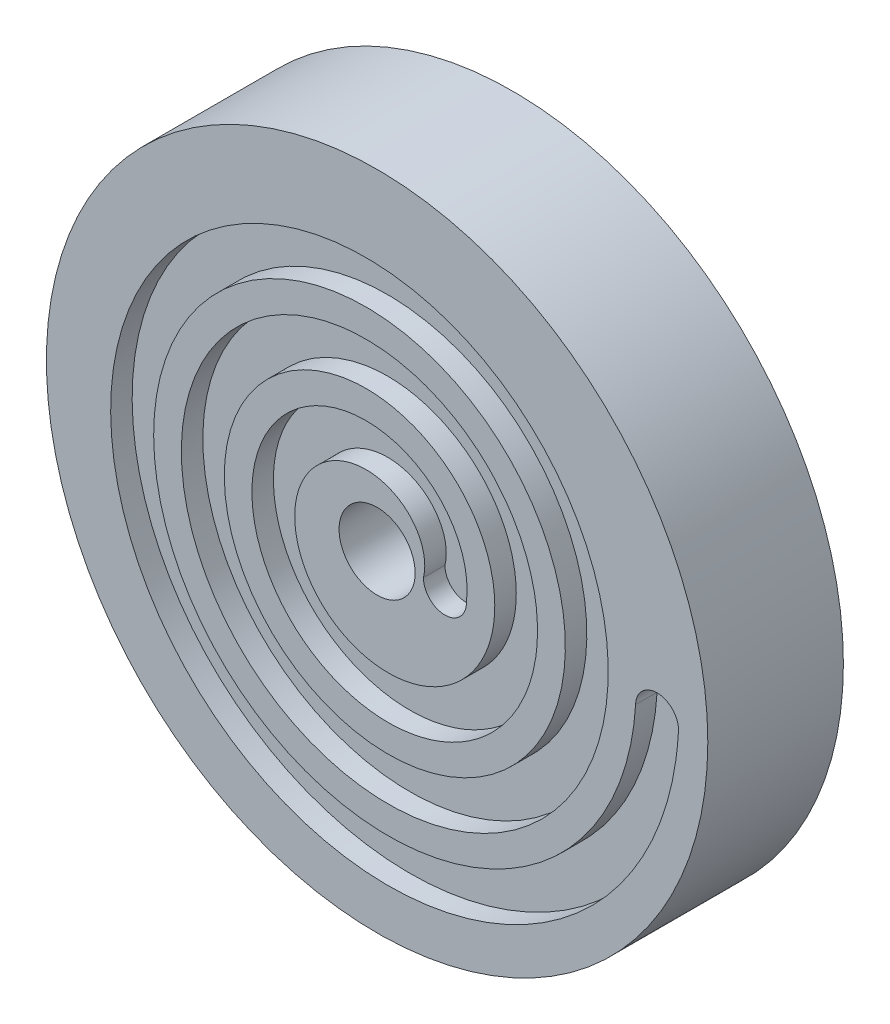
from build123d import *

# Parameters (mm, degrees)
SKETCH4_R           = 100
SKETCH4_R_2         = 5.5
SKETCH4_R_3         = 1.5
BOSS_EXTRUDE1_DEPTH = 41
SKETCH3_R           = 8.249941975
SKETCH3_R_2         = 8.2
SKETCH3_R_3         = 8.4
CUT_EXTRUDE1_DEPTH  = 15.6
SKETCH15_R          = 8.2
SKETCH15_R_2        = 8.249941975
SKETCH15_R_3        = 8.4
CUT_EXTRUDE12_DEPTH = 16.4
CUT_EXTRUDE12_TAPER = 20
SKETCH6_R           = 11.5
CUT_EXTRUDE3_DEPTH  = 38.6
CUT_EXTRUDE13_DEPTH = 6.5


with BuildPart() as part:
    # Sketch4 → Boss-Extrude1 (new body)
    with BuildSketch(Plane.XY):
        Circle(SKETCH4_R)
        Circle(SKETCH4_R_2, mode=Mode.SUBTRACT)
        with Locations((-8, 0)):
            Circle(SKETCH4_R_3, mode=Mode.SUBTRACT)
        with Locations((8, 0)):
            Circle(SKETCH4_R_3, mode=Mode.SUBTRACT)
        with Locations((0, 8)):
            Circle(SKETCH4_R_3, mode=Mode.SUBTRACT)
        with Locations((0, -8)):
            Circle(SKETCH4_R_3, mode=Mode.SUBTRACT)
    extrude(amount=BOSS_EXTRUDE1_DEPTH)

    # Sketch3 → Cut-Extrude1 (cut)
    with BuildSketch(Plane.XY):
        with Locations((21.4, 0)):
            Circle(SKETCH3_R)
        with Locations((16.087685707, 18.190157142)):
            Circle(SKETCH3_R_2)
        with Locations((-0.774491715, 26.837091431)):
            Circle(SKETCH3_R_2)
        with Locations((-19.110818022, 22.053615962)):
            Circle(SKETCH3_R_2)
        with Locations((-30.557474359, 6.951412193)):
            Circle(SKETCH3_R_2)
        with Locations((-31.122710428, -11.990156068)):
            Circle(SKETCH3_R_2)
        with Locations((-21.220186354, -28.146966302)):
            Circle(SKETCH3_R_2)
        with Locations((-4.356772791, -36.791489598)):
            Circle(SKETCH3_R_2)
        with Locations((14.573130819, -35.918993574)):
            Circle(SKETCH3_R_2)
        with Locations((30.806228108, -26.142028174)):
            Circle(SKETCH3_R_2)
        with Locations((40.765665437, -10.020238321)):
            Circle(SKETCH3_R_2)
        with Locations((42.589055998, 8.841833327)):
            Circle(SKETCH3_R_2)
        with Locations((36.192728346, 26.679700144)):
            Circle(SKETCH3_R_2)
        with Locations((22.997258321, 40.280511548)):
            Circle(SKETCH3_R_2)
        with Locations((5.454874382, 47.447607593)):
            Circle(SKETCH3_R_2)
        with Locations((-13.495125618, 47.207297832)):
            Circle(SKETCH3_R_2)
        with Locations((-30.933667375, 39.791115431)):
            Circle(SKETCH3_R_2)
        with Locations((-44.388521746, 26.446850976)):
            Circle(SKETCH3_R_2)
        with Locations((-52.112569576, 9.142470458)):
            Circle(SKETCH3_R_2)
        with Locations((-53.228480323, -9.774644629)):
            Circle(SKETCH3_R_2)
        with Locations((-47.740836122, -27.912678181)):
            Circle(SKETCH3_R_2)
        with Locations((-36.441454543, -43.125385892)):
            Circle(SKETCH3_R_2)
        with Locations((-20.738121403, -53.732356633)):
            Circle(SKETCH3_R_2)
        with Locations((-2.439397282, -58.657719113)):
            Circle(SKETCH3_R_2)
        with Locations((16.474376824, -57.486544888)):
            Circle(SKETCH3_R_2)
        with Locations((34.068250676, -50.446793268)):
            Circle(SKETCH3_R_2)
        with Locations((48.6385902, -38.330370275)):
            Circle(SKETCH3_R_2)
        with Locations((58.854915628, -22.370132346)):
            Circle(SKETCH3_R_2)
        with Locations((63.851191035, -4.090642964)):
            Circle(SKETCH3_R_2)
        with Locations((63.265715225, 14.850310498)):
            Circle(SKETCH3_R_2)
        with Locations((57.233338919, 32.814523148)):
            Circle(SKETCH3_R_2)
        with Locations((46.337082588, 48.318525791)):
            Circle(SKETCH3_R_2)
        with Locations((31.528394784, 60.14245346)):
            Circle(SKETCH3_R_2)
        with Locations((14.02631126, 67.40740854)):
            Circle(SKETCH3_R_2)
        with Locations((-4.794157343, 69.619299485)):
            Circle(SKETCH3_R_2)
        with Locations((-23.51480359, 66.679928104)):
            Circle(SKETCH3_R_2)
        with Locations((-40.779852981, 58.868361711)):
            Circle(SKETCH3_R_2)
        with Locations((-55.387799155, 46.797305064)):
            Circle(SKETCH3_R_2)
        with Locations((-66.364652435, 31.350260296)):
            Circle(SKETCH3_R_2)
        with Locations((-73.015701888, 13.60579521)):
            Circle(SKETCH3_R_2)
        with Locations((-74.954667493, -5.244746225)):
            Circle(SKETCH3_R_2)
        with Locations((-72.110731724, -23.980127975)):
            Circle(SKETCH3_R_2)
        with Locations((-64.715218858, -41.427445518)):
            Circle(SKETCH3_R_2)
        with Locations((-53.27083426, -56.531370875)):
            Circle(SKETCH3_R_2)
        with Locations((-21.324502844, -76.402883691)):
            Circle(SKETCH3_R_2)
        with Locations((-2.736063948, -80.086962869)):
            Circle(SKETCH3_R_2)
        with Locations((16.197542751, -79.298903632)):
            Circle(SKETCH3_R_2)
        with Locations((-38.506875647, -68.411102609)):
            Circle(SKETCH3_R_2)
        with Locations((34.427838761, -74.126012041)):
            Circle(SKETCH3_R_2)
        with Locations((50.974911884, -64.890381524)):
            Circle(SKETCH3_R_2)
        with Locations((64.976177653, -52.120610309)):
            Circle(SKETCH3_R_3)
    extrude(amount=CUT_EXTRUDE1_DEPTH, mode=Mode.SUBTRACT)

    # Sketch15 → Cut-Extrude12 (cut)
    with BuildSketch(Plane.XY.offset(15.6)):
        with Locations((16.087685707, 18.190157143)):
            Circle(SKETCH15_R)
        with Locations((-0.774491715, 26.837091431)):
            Circle(SKETCH15_R)
        with Locations((-19.110818022, 22.053615962)):
            Circle(SKETCH15_R)
        with Locations((-30.557474359, 6.951412193)):
            Circle(SKETCH15_R)
        with Locations((-31.122710428, -11.990156068)):
            Circle(SKETCH15_R)
        with Locations((-21.220186354, -28.146966302)):
            Circle(SKETCH15_R)
        with Locations((-4.356772791, -36.791489598)):
            Circle(SKETCH15_R)
        with Locations((14.573130819, -35.918993574)):
            Circle(SKETCH15_R)
        with Locations((30.806228108, -26.142028174)):
            Circle(SKETCH15_R)
        with Locations((40.765665437, -10.020238321)):
            Circle(SKETCH15_R)
        with Locations((42.589055998, 8.841833327)):
            Circle(SKETCH15_R)
        with Locations((36.192728346, 26.679700144)):
            Circle(SKETCH15_R)
        with Locations((22.997258321, 40.280511548)):
            Circle(SKETCH15_R)
        with Locations((5.454874382, 47.447607593)):
            Circle(SKETCH15_R)
        with Locations((-13.495125618, 47.207297832)):
            Circle(SKETCH15_R)
        with Locations((-30.933667375, 39.791115431)):
            Circle(SKETCH15_R)
        with Locations((-44.388521746, 26.446850976)):
            Circle(SKETCH15_R)
        with Locations((-52.112569576, 9.142470458)):
            Circle(SKETCH15_R)
        with Locations((-53.228480323, -9.774644629)):
            Circle(SKETCH15_R)
        with Locations((-47.740836122, -27.912678181)):
            Circle(SKETCH15_R)
        with Locations((-36.441454543, -43.125385892)):
            Circle(SKETCH15_R)
        with Locations((-20.738121403, -53.732356633)):
            Circle(SKETCH15_R)
        with Locations((-2.439397282, -58.657719113)):
            Circle(SKETCH15_R)
        with Locations((16.474376824, -57.486544888)):
            Circle(SKETCH15_R)
        with Locations((34.068250676, -50.446793268)):
            Circle(SKETCH15_R)
        with Locations((48.6385902, -38.330370275)):
            Circle(SKETCH15_R)
        with Locations((58.854915628, -22.370132346)):
            Circle(SKETCH15_R)
        with Locations((63.851191035, -4.090642964)):
            Circle(SKETCH15_R)
        with Locations((63.265715225, 14.850310498)):
            Circle(SKETCH15_R)
        with Locations((57.233338919, 32.814523148)):
            Circle(SKETCH15_R)
        with Locations((46.337082588, 48.318525791)):
            Circle(SKETCH15_R)
        with Locations((31.528394784, 60.14245346)):
            Circle(SKETCH15_R)
        with Locations((14.02631126, 67.40740854)):
            Circle(SKETCH15_R)
        with Locations((-4.794157343, 69.619299485)):
            Circle(SKETCH15_R)
        with Locations((-23.51480359, 66.679928104)):
            Circle(SKETCH15_R)
        with Locations((-40.779852981, 58.868361711)):
            Circle(SKETCH15_R)
        with Locations((-55.387799155, 46.797305064)):
            Circle(SKETCH15_R)
        with Locations((-66.364652435, 31.350260296)):
            Circle(SKETCH15_R)
        with Locations((-73.015701888, 13.60579521)):
            Circle(SKETCH15_R)
        with Locations((-74.954667493, -5.244746225)):
            Circle(SKETCH15_R)
        with Locations((-72.110731724, -23.980127975)):
            Circle(SKETCH15_R)
        with Locations((-64.715218858, -41.427445518)):
            Circle(SKETCH15_R)
        with Locations((-53.27083426, -56.531370875)):
            Circle(SKETCH15_R)
        with Locations((-21.324502844, -76.402883691)):
            Circle(SKETCH15_R)
        with Locations((-2.736063948, -80.086962869)):
            Circle(SKETCH15_R)
        with Locations((16.197542751, -79.298903632)):
            Circle(SKETCH15_R)
        with Locations((-38.506875647, -68.411102609)):
            Circle(SKETCH15_R)
        with Locations((34.427838761, -74.126012041)):
            Circle(SKETCH15_R)
        with Locations((50.974911884, -64.890381524)):
            Circle(SKETCH15_R)
        with Locations((21.4, 0)):
            Circle(SKETCH15_R_2)
        with Locations((64.976177653, -52.120610309)):
            Circle(SKETCH15_R_3)
    extrude(amount=CUT_EXTRUDE12_DEPTH, taper=CUT_EXTRUDE12_TAPER, mode=Mode.SUBTRACT)

    # Sketch6 → Cut-Extrude3 (cut)
    with BuildSketch(Plane.XY.offset(41)):
        Circle(SKETCH6_R)
    extrude(amount=-CUT_EXTRUDE3_DEPTH, mode=Mode.SUBTRACT)

    # Sketch16 → Cut-Extrude13 (cut)
    with BuildSketch(Plane.XY.offset(41)):
        with BuildLine():
            add(Edge.make_bspline(
                [(14.016506821, 0.058890958), (14.030574535, 0.116716229), (14.057928972, 0.232859004), (14.104443607, 0.440692181), (14.16063629, 0.715902607), (14.220020621, 1.042704993), (14.281273921, 1.437343973), (14.339018355, 1.904396529), (14.383943259, 2.436853645), (14.409163219, 2.972356735), (14.414178912, 3.507524072), (14.400801014, 3.995209172), (14.374468574, 4.434233739), (14.33262169, 4.910561619), (14.271432193, 5.423399716), (14.123061594, 6.358742999), (13.843675569, 7.532641897), (13.400923875, 8.853033449), (12.748018385, 10.28821652), (12.049784249, 11.521411814), (11.239008296, 12.699181377), (10.102628408, 14.078658887), (8.558785803, 15.572180082), (6.531913632, 17.053121526), (3.975685711, 18.353947247), (1.249227269, 19.242541549), (-1.579574136, 19.709530886), (-4.445829595, 19.755622123), (-7.288637583, 19.390176133), (-10.051801675, 18.63028947), (-12.684444392, 17.499185446), (-15.392709382, 15.875078562), (-18.057901444, 13.676220687), (-21.275934542, 9.987915161), (-24.195506858, 4.315677697), (-25.535539666, -3.153146414), (-24.092076196, -11.764773521), (-19.952360348, -19.437726336), (-13.644024825, -25.439231987), (-5.8377308, -29.274029228), (2.735606339, -30.68616375), (11.353928774, -29.641306539), (19.357711549, -26.295728306), (26.188520056, -20.957885021), (31.413305575, -14.046800183), (34.736362346, -6.050750873), (36.000713563, 2.511223909), (35.181153937, 11.123250755), (32.370965466, 19.301292866), (27.764286374, 26.615640725), (21.635814835, 32.707546426), (14.319295246, 37.2999838), (6.186055674, 40.20306017), (-2.375486418, 41.314818693), (-10.978574543, 40.61805958), (-19.254287918, 38.173764196), (-26.865733738, 34.112304836), (-34.399674023, 27.895198951), (-41.641770411, 18.365513654), (-46.646531233, 5.014292638), (-46.83439662, -11.490474185), (-40.751998747, -27.915741612), (-29.329328027, -41.169358956), (-14.086268223, -49.724401059), (3.121864615, -52.704434499), (20.346471287, -49.907809195), (35.76184155, -41.757844852), (47.83830905, -29.196035285), (55.462713309, -13.539541851), (58.003920293, 3.678009305), (55.326397306, 20.865316223), (47.758668261, 36.517691793), (36.026348394, 49.33694563), (21.16024185, 58.32093463), (4.390465358, 62.819465545), (-12.963412332, 62.557299127), (-29.597563451, 57.626701234), (-44.317018546, 48.454228793), (-56.112342987, 35.747175454), (-64.216079082, 20.425898), (-68.137801395, 3.548245412), (-67.678038673, -13.768124536), (-62.922479609, -30.420247316), (-54.219185031, -45.38720808), (-43.651361889, -56.236760006), (-32.954454266, -63.494325094), (-23.221801799, -68.02856966), (-15.058604975, -70.70103381), (-6.636311382, -72.386063039), (1.925790494, -73.065612602), (10.508228023, -72.735811745), (18.993339126, -71.406716641), (27.266597386, -69.101746745), (35.218206373, -65.857047567), (42.744362943, -61.720640911), (49.748476928, -56.751515747), (56.142212764, -51.018573978), (61.84646485, -44.599480968), (66.483003279, -38.018212975), (69.630451094, -32.402983303), (71.669044582, -28.032192447), (72.890905092, -25.059669464), (73.650031993, -23.056101044), (74.3531948, -21.032200415), (74.999918121, -18.989587808), (75.58977707, -16.9297969), (76.122382679, -14.854527811), (76.597406628, -12.765221981), (77.014539663, -10.663772319), (77.32868567, -8.815349339), (77.561470199, -7.225764804), (77.731145655, -5.897109574), (77.852187948, -4.833599155), (77.958682677, -3.766886567), (78.039130941, -2.830812788), (78.097695572, -2.048738747), (78.136069915, -1.454765093), (78.15064743, -1.215692758), (78.157590282, -1.096828249)],
                knots=[0.021797208, 0.021797208, 0.021797208, 0.021797208, 0.021797208, 0.022070601, 0.022343994, 0.022617387, 0.02289078, 0.023437566, 0.023984352, 0.024531138, 0.025077924, 0.02562471, 0.026171496, 0.026523079, 0.026874662, 0.027577829, 0.028280995, 0.030390495, 0.031796828, 0.033255306, 0.034713783, 0.036172261, 0.037630738, 0.040547765, 0.043464792, 0.046382033, 0.049299273, 0.052216621, 0.055133969, 0.058051462, 0.060968955, 0.063886241, 0.066803528, 0.070914401, 0.075025275, 0.083776953, 0.092528419, 0.101280003, 0.110031978, 0.118783654, 0.127535121, 0.136286831, 0.145038746, 0.153790412, 0.16254192, 0.171293761, 0.18004559, 0.188797183, 0.197548795, 0.206300627, 0.215052496, 0.223804074, 0.232555695, 0.241307631, 0.250059377, 0.258810962, 0.267562665, 0.276314579, 0.285066304, 0.298455126, 0.315958252, 0.333461537, 0.350964737, 0.36846801, 0.385971403, 0.403474742, 0.420977928, 0.438481325, 0.455984635, 0.473487957, 0.490991256, 0.50849458, 0.525997955, 0.543501446, 0.561004684, 0.578508057, 0.59601144, 0.613514849, 0.6310183, 0.648521662, 0.666025025, 0.683528428, 0.701031873, 0.718535323, 0.736038666, 0.753542142, 0.762293873, 0.771045605, 0.779797319, 0.788549034, 0.797300747, 0.806052461, 0.814804161, 0.82355586, 0.832307543, 0.841059225, 0.849810982, 0.858562738, 0.867314419, 0.8760661, 0.882629917, 0.884817856, 0.887005794, 0.889193733, 0.891381672, 0.893569611, 0.895757552, 0.897945493, 0.900133434, 0.902321374, 0.904509315, 0.905603285, 0.906697256, 0.907791226, 0.908885196, 0.909979167, 0.910526152, 0.911073137, 0.911073137, 0.911073137, 0.911073137, 0.911073137], degree=4))
            ThreePointArc((14.016506821, 0.058890958), (20.478807931, -6.462301111), (27, 0))
            add(Edge.make_bspline(
                [(27, 0), (27.012739488, 0.100990806), (27.036662544, 0.301357926), (27.08007804, 0.693733517), (27.122697184, 1.159954432), (27.151882127, 1.559556129), (27.172474927, 1.906834305), (27.189208246, 2.255296673), (27.201944335, 2.603796035), (27.210920791, 3.009886722), (27.213266128, 3.474287749), (27.207699312, 3.938733208), (27.163906616, 5.447543308), (26.983883763, 7.299839782), (26.585879779, 9.475040065), (25.878898367, 11.931545894), (25.187746783, 13.849179676), (24.28422983, 15.875178652), (23.13283807, 17.979244172), (21.700129204, 20.122283143), (20.052019791, 22.172952205), (18.190820043, 24.10706676), (16.121864453, 25.899645529), (13.853790414, 27.52533588), (11.447221202, 28.937881804), (8.923198601, 30.127846853), (6.303093091, 31.087857374), (3.608419345, 31.812552164), (0.860708309, 32.298543174), (-1.918743906, 32.5443425), (-4.708978431, 32.550313014), (-7.489523033, 32.318520967), (-10.928137463, 31.736319164), (-14.956977718, 30.580266173), (-19.434944922, 28.594213656), (-24.116201975, 25.525140807), (-28.247160837, 21.74883894), (-31.732756976, 17.370496363), (-35.189260731, 11.289708766), (-37.786229321, 3.26311959), (-38.40323412, -6.614775737), (-35.828505022, -17.62022044), (-30.268166493, -27.451854964), (-22.227155159, -35.37436817), (-12.359923315, -40.844401386), (-1.407702232, -43.528219226), (9.861036151, -43.302612171), (20.703438331, -40.241801157), (30.446441071, -34.59388519), (38.521090271, -26.749704853), (44.486412297, -17.207228633), (48.043193614, -6.53427377), (49.038504965, 4.668252409), (47.46195427, 15.800656351), (43.435056274, 26.29508879), (37.195172281, 35.641238539), (29.07565872, 43.406606686), (19.483333963, 49.251203762), (8.874974771, 52.936547392), (-2.266370549, 54.329262909), (-13.45377851, 53.400118987), (-24.217303988, 50.218207634), (-34.121827115, 44.942532549), (-42.782826393, 37.80919418), (-51.19505312, 27.50543576), (-58.125446718, 12.864594868), (-60.776618592, -6.143787337), (-55.926184539, -27.685242585), (-43.255931225, -46.631660559), (-24.731552991, -59.877752243), (-2.783641133, -65.883807353), (19.881754851, -64.067123739), (40.621302412, -54.783800233), (57.145304349, -39.207977312), (67.735958985, -19.136422569), (71.381558574, 3.250194948), (67.823910288, 25.638844955), (57.52670101, 45.822154372), (41.577932435, 61.901822033), (21.544207816, 72.442996411), (-0.70420917, 76.571772757), (-23.178444361, 74.014145882), (-43.9493714, 65.07994323), (-61.304597959, 50.599521164), (-73.874594393, 31.823569111), (-79.864659761, 12.988722809), (-81.133179848, -3.809003087), (-79.317927652, -20.483437692), (-74.481864819, -36.617305957), (-66.094423653, -51.319040702), (-54.702507123, -63.717337263), (-41.352009346, -73.865323636), (-28.863979091, -80.258288669), (-16.79204499, -83.951913485), (-5.743537725, -85.56160931), (1.216603062, -85.965084617), (6.793783564, -85.925869814), (13.747515003, -85.425745468), (20.638776221, -84.328451279), (27.410441771, -82.644171951), (35.326979157, -79.939351226), (41.714040276, -77.12930969), (47.839297618, -73.78711739), (53.654966908, -69.942707333), (58.103541067, -66.578926645), (63.38770595, -62.031566557), (68.764870852, -56.554662484), (73.165099707, -51.135206023), (77.093639987, -45.375775265), (79.58621277, -41.181983938), (81.240747486, -38.115119845), (82.766498474, -34.983013543), (83.908742056, -32.44067456), (85.237345547, -29.219972451), (86.432131361, -25.946550559), (87.490992574, -22.626538592), (88.412197458, -19.266681826), (89.065984579, -16.557070826), (89.636025313, -13.829160767), (90.121958288, -11.084011083), (90.473099923, -8.671845147), (90.721252543, -6.594047762), (90.875134114, -5.039440872), (90.965623673, -3.979245177), (91.028582124, -3.163213889), (91.078675077, -2.414132114), (91.112620944, -1.845104273), (91.129561363, -1.540078495), (91.137585564, -1.387590888)],
                knots=[0.035606517, 0.035606517, 0.035606517, 0.035606517, 0.035606517, 0.035971793, 0.036337069, 0.036702344, 0.03706762, 0.037250258, 0.037432896, 0.037798172, 0.038163448, 0.038528724, 0.038894, 0.039259276, 0.042912076, 0.04437322, 0.045834365, 0.047295509, 0.049320387, 0.051345265, 0.053370143, 0.055395021, 0.057586735, 0.059778448, 0.061970162, 0.064161876, 0.066353741, 0.068545607, 0.070737472, 0.072929337, 0.07512122, 0.077313103, 0.079504985, 0.081696868, 0.086080315, 0.090463763, 0.094847294, 0.099230825, 0.103614507, 0.107998189, 0.116765682, 0.125532674, 0.134299692, 0.143067096, 0.151834485, 0.160601607, 0.169368712, 0.178136099, 0.186903479, 0.195670624, 0.204437735, 0.213205109, 0.221972478, 0.230739618, 0.239506807, 0.248274166, 0.257041498, 0.265808698, 0.274575868, 0.283343286, 0.292110583, 0.300877758, 0.309644959, 0.318412384, 0.327179675, 0.335946867, 0.351226859, 0.368761226, 0.386295557, 0.403829795, 0.421364179, 0.438898498, 0.45643288, 0.473967216, 0.491501602, 0.50903609, 0.526570384, 0.544104786, 0.561639198, 0.579173699, 0.596708036, 0.614242489, 0.631776923, 0.649311342, 0.666845844, 0.684380239, 0.70191474, 0.710681985, 0.71944923, 0.736983661, 0.754518082, 0.763285335, 0.772052587, 0.789587033, 0.798354314, 0.802737955, 0.807121595, 0.811505208, 0.81588882, 0.824656045, 0.829039662, 0.833423279, 0.842190512, 0.846574138, 0.850957763, 0.855341389, 0.859725014, 0.86849225, 0.875067676, 0.877259485, 0.881643097, 0.883834903, 0.886026709, 0.888218515, 0.890410321, 0.894793933, 0.896985758, 0.899177584, 0.90136941, 0.903561236, 0.905753061, 0.907944887, 0.9090408, 0.910136713, 0.910684669, 0.911232626, 0.911780582, 0.912328539, 0.912328539, 0.912328539, 0.912328539, 0.912328539], degree=4))
            ThreePointArc((91.137585564, -1.387590888), (84.792969241, 5.247788072), (78.157590282, -1.09682825))
        make_face()
    extrude(amount=-CUT_EXTRUDE13_DEPTH, mode=Mode.SUBTRACT)


solid = part.part
